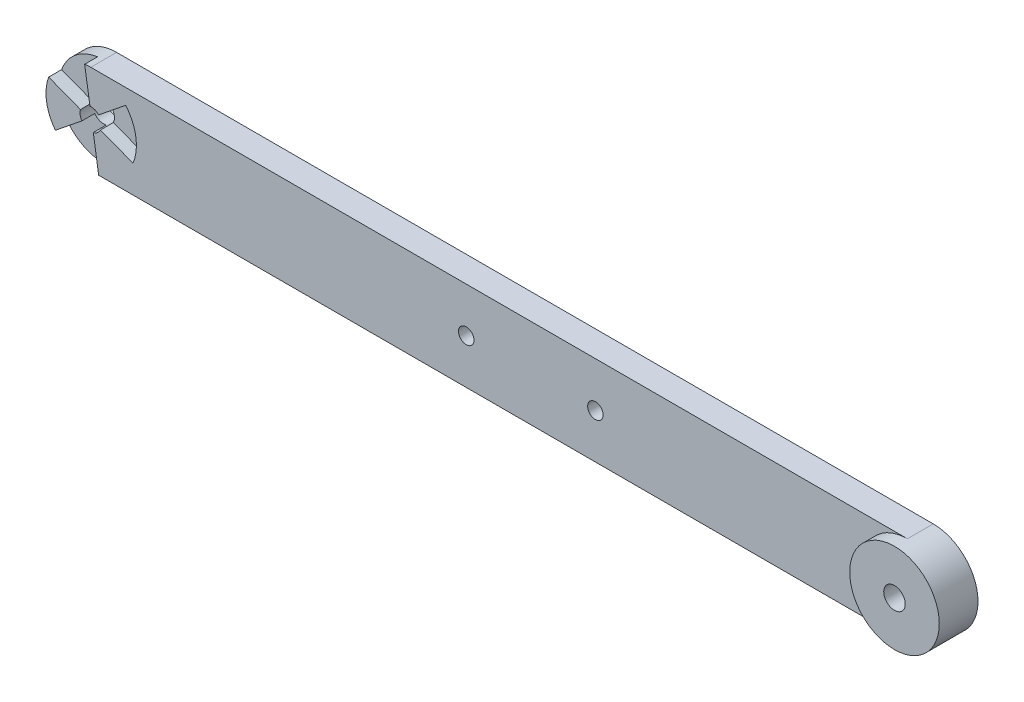
from build123d import *
from build123d.topology import SkipClean

# Parameters (mm, degrees)
SKETCH1_R            = 2.5
BOSS_EXTRUDE1_DEPTH  = 6
CUT_EXTRUDE3_DEPTH   = 3
BOSS_EXTRUDE2_START  = 3
SKETCH4_R            = 2.5
BOSS_EXTRUDE2_DEPTH  = 3
M3_CLEARANCE_HOLE1_D = 3.6


with BuildPart() as part:
    # Sketch1 → Boss-Extrude1 (new body)
    with BuildSketch(Plane.XY):
        with BuildLine():
            Line((0, -10.4), (189.7, -10.4))
            ThreePointArc((189.7, -10.4), (200.1, 0), (189.7, 10.4))
            Line((189.7, 10.4), (0, 10.4))
            ThreePointArc((0, 10.4), (-10.4, 0), (0, -10.4))
        make_face()
        Circle(SKETCH1_R, mode=Mode.SUBTRACT)
        with Locations((189.7, 0)):
            Circle(SKETCH1_R, mode=Mode.SUBTRACT)
    extrude(amount=BOSS_EXTRUDE1_DEPTH)

    # Sketch6 → Cut-Extrude3 (cut)
    with BuildSketch(Plane(origin=(0, 0, 0), x_dir=(-1, 0, 0), z_dir=(0, 0, -1))):
        with BuildLine():
            ThreePointArc((0.189684667, 2.492793559), (1.571265552, 1.944511395), (2.39740304, 0.708843186))
            Line((2.39740304, 0.708843186), (9.962077265, 3.621742201))
            ThreePointArc((9.962077265, 3.621742201), (6.66216594, 8.244728315), (1.449377234, 10.500443116))
            Line((1.449377234, 10.500443116), (0.189684667, 2.492793559))
        make_face()
        with BuildLine():
            ThreePointArc((2.063980215, -1.41066852), (0.89836349, -2.333011582), (-0.584825314, -2.430633529))
            Line((-0.584825314, -2.430633529), (-1.844517881, -10.438283086))
            ThreePointArc((-1.844517881, -10.438283086), (3.809061198, -9.891969106), (8.368961872, -6.505419062))
            Line((8.368961872, -6.505419062), (2.063980215, -1.41066852))
        make_face()
        with BuildLine():
            Line((-9.818339107, -3.995024054), (-2.253664882, -1.082125039))
            ThreePointArc((-2.253664882, -1.082125039), (-2.469629042, 0.388500187), (-1.812577726, 1.721790343))
            Line((-1.812577726, 1.721790343), (-8.117559384, 6.816540886))
            ThreePointArc((-8.117559384, 6.816540886), (-10.471227138, 1.647240791), (-9.818339107, -3.995024054))
        make_face()
    extrude(amount=-CUT_EXTRUDE3_DEPTH, mode=Mode.SUBTRACT)

    # Sketch4 → Boss-Extrude2 (add)
    with SkipClean():  # the faces are left unmerged after this step: merging them gives an invalid solid
        with BuildSketch(Plane(origin=(0, 0, 0), x_dir=(-1, 0, 0), z_dir=(0, 0, -1)).offset(BOSS_EXTRUDE2_START)):
            with BuildLine():
                ThreePointArc((-189.7, 10.4), (-200.1, 0), (-189.7, -10.4))
                ThreePointArc((-189.7, -10.4), (-179.3, 0), (-189.7, 10.4))
            make_face()
            with Locations((-189.7, 0)):
                Circle(SKETCH4_R, mode=Mode.SUBTRACT)
        extrude(amount=-BOSS_EXTRUDE2_DEPTH)


with BuildPart() as body_2:
    # Mirror1: mirrored copy
    add(part.part.mirror(Plane.XY))

    # M3 Clearance Hole1 (through all)
    with Locations(Plane(origin=(0, 0, -6), x_dir=(-1, 0, 0), z_dir=(0, 0, -1))):
        with Locations((-117.221225002, -0.052328238), (-87.221316277, 0)):
            Hole(M3_CLEARANCE_HOLE1_D / 2)


solid = body_2.part
